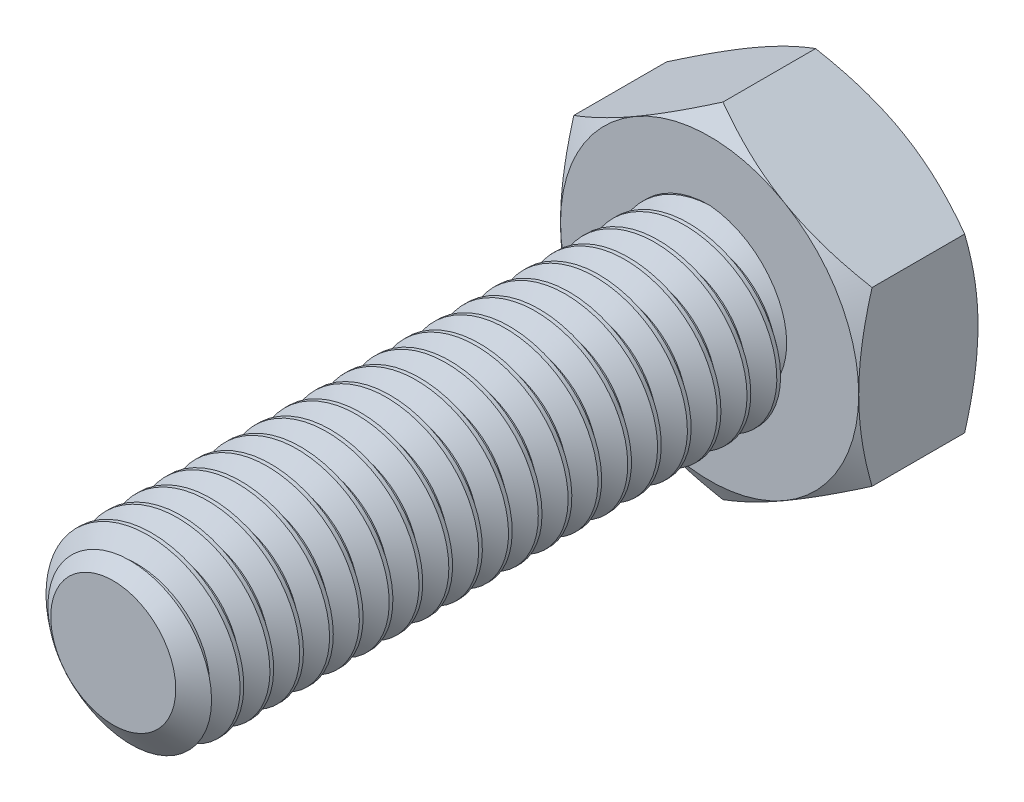
from build123d import *

# Parameters (mm, degrees)
SKETCH1_R          = 3
EXTRUDE1_DEPTH     = 20
CUT_SWEEP1_PITCH   = 1
EXTRUDE2_DEPTH     = 4
SKETCH10_OUTSIDE_W = 108.4
SKETCH10_OUTSIDE_H = 109.948
SKETCH10_OUTSIDE_R = 5
CUT_EXTRUDE1_DEPTH = 26.185975071
CUT_EXTRUDE1_DRAFT = -60
SKETCH11_OUTSIDE_W = 95.316
SKETCH11_OUTSIDE_H = 96.864
SKETCH11_OUTSIDE_R = 5
CUT_EXTRUDE2_DEPTH = 22.408721108
CUT_EXTRUDE2_DRAFT = -60


with BuildPart() as part:
    # Sketch1 → Extrude1 (new body)
    with BuildSketch(Plane.XY):
        Circle(SKETCH1_R)
    extrude(amount=-EXTRUDE1_DEPTH)

    # Cut-Sweep1: the profile of Sketch3 profile screwed along a right-hand helix of 21 turns, 6 arcs to a turn; built about Z, then put on its axis
    cut_sweep1_z = Axis((0, 0, 0), (0, 0, 1))
    cut_sweep1_corners = [(3.0003, 0, -0.875173205), (2.350480947, 0, -0.5), (2.350480947, 0, -0.375), (3.0003, 0, 0.000173205)]
    with BuildLine(mode=Mode.PRIVATE) as cut_sweep1_profile:
        Line(cut_sweep1_corners[0], cut_sweep1_corners[1])
        Line(cut_sweep1_corners[1], cut_sweep1_corners[2])
        Line(cut_sweep1_corners[2], cut_sweep1_corners[3])
        Line(cut_sweep1_corners[3], cut_sweep1_corners[0])
    cut_sweep1_cap = Face(cut_sweep1_profile.wire())
    cut_sweep1_turn_angles = [0, 30, 60, 90, 120, 150, 180, 210, 240, 270, 300, 330, 360]
    cut_sweep1_turn_weights = [1, 0.8660254037844387, 1, 0.8660254037844387, 1, 0.8660254037844387, 1, 0.8660254037844387, 1, 0.8660254037844387, 1, 0.8660254037844387, 1]
    cut_sweep1_turn_rails = [Edge.make_bspline([Vector(p[0], p[1], 0).rotate(cut_sweep1_z, cut_sweep1_turn_angles[k]) / cut_sweep1_turn_weights[k] + Vector(0, 0, p[2] + CUT_SWEEP1_PITCH * cut_sweep1_turn_angles[k] / 360) for k in range(13)], [0, 0, 0, 1, 1, 2, 2, 3, 3, 4, 4, 5, 5, 6, 6, 6], 2, cut_sweep1_turn_weights) for p in cut_sweep1_corners]
    cut_sweep1_turn_sides = [Face.make_surface_from_curves(cut_sweep1_turn_rails[p[0]], cut_sweep1_turn_rails[p[1]]) for p in [(0, 1), (1, 2), (2, 3), (3, 0)]]
    cut_sweep1 = Plane(origin=(0, 0, 0), x_dir=(0, 1, 0), z_dir=(0, 0, -1)) * Solid(Shell([*[p.moved(Location((0, 0, CUT_SWEEP1_PITCH * i))) for i in range(21) for p in cut_sweep1_turn_sides], cut_sweep1_cap, cut_sweep1_cap.rotate(cut_sweep1_z, 7560).moved(Location((0, 0, CUT_SWEEP1_PITCH * 7560 / 360)))]))
    add(cut_sweep1, mode=Mode.SUBTRACT)

    # Sketch4 → Cut-Revolve1 (revolve, cut)
    with BuildSketch(Plane(origin=(0, 0, 0), x_dir=(0, 0, -1), z_dir=(1, 0, 0)), mode=Mode.PRIVATE) as cut_revolve1_sk:
        Polygon((0.632650852, 3), (0, 2.096480947), (0, 3), align=None)
    revolve(cut_revolve1_sk.sketch.rotate(Axis((0, 0, 0), (0, 0, -1)), 244.349292568), axis=Axis((0, 0, 0), (0, 0, -1)), mode=Mode.SUBTRACT)

    # Sketch6 → Extrude2 (add)
    with BuildSketch(Plane.XY.offset(-20)):
        Polygon((0, 5.773502692), (-5, 2.886751346), (-5, -2.886751346), (0, -5.773502692), (5, -2.886751346), (5, 2.886751346), align=None)
    extrude(amount=-EXTRUDE2_DEPTH)


with BuildPart() as cut_extrude1_tool:
    # Sketch10 outside → Cut-Extrude1 (with draft: the straight prism first)
    with BuildSketch(Plane(origin=(0, 0, -24), x_dir=(-1, 0, 0), z_dir=(0, 0, -1))):
        Rectangle(SKETCH10_OUTSIDE_W, SKETCH10_OUTSIDE_H)
        Circle(SKETCH10_OUTSIDE_R, mode=Mode.SUBTRACT)
    extrude(amount=-CUT_EXTRUDE1_DEPTH)
    # Cut-Extrude1: the draft: its side faces are tilted about the plane it starts from
    cut_extrude1_sides = [cut_extrude1_tool.faces().sort_by_distance(p)[0] for p in [
        (0, -54.974, -10.907012464),
        (-54.2, 0, -10.907012464),
        (0, 54.974, -10.907012464),
        (54.2, 0, -10.907012464),
        (5, 0, -10.907012464),
    ]]
    draft(cut_extrude1_sides, Plane(origin=(0, 0, -24), x_dir=(-1, 0, 0), z_dir=(0, 0, -1)), CUT_EXTRUDE1_DRAFT)


with BuildPart() as part_1:
    add(part.part)

    # Cut-Extrude1: cut by cut_extrude1_tool
    add(cut_extrude1_tool.part, mode=Mode.SUBTRACT)


with BuildPart() as cut_extrude2_tool:
    # Sketch11 outside → Cut-Extrude2 (with draft: the straight prism first)
    with BuildSketch(Plane.XY.offset(-20)):
        Rectangle(SKETCH11_OUTSIDE_W, SKETCH11_OUTSIDE_H)
        Circle(SKETCH11_OUTSIDE_R, mode=Mode.SUBTRACT)
    extrude(amount=-CUT_EXTRUDE2_DEPTH)
    # Cut-Extrude2: the draft: its side faces are tilted about the plane it starts from
    cut_extrude2_sides = [cut_extrude2_tool.faces().sort_by_distance(p)[0] for p in [
        (0, -48.432, -31.204360554),
        (47.658, 0, -31.204360554),
        (0, 48.432, -31.204360554),
        (-47.658, 0, -31.204360554),
        (-5, 0, -31.204360554),
    ]]
    draft(cut_extrude2_sides, Plane.XY.offset(-20), CUT_EXTRUDE2_DRAFT)


with BuildPart() as part_2:
    add(part_1.part)

    # Cut-Extrude2: cut by cut_extrude2_tool
    add(cut_extrude2_tool.part, mode=Mode.SUBTRACT)


solid = part_2.part
